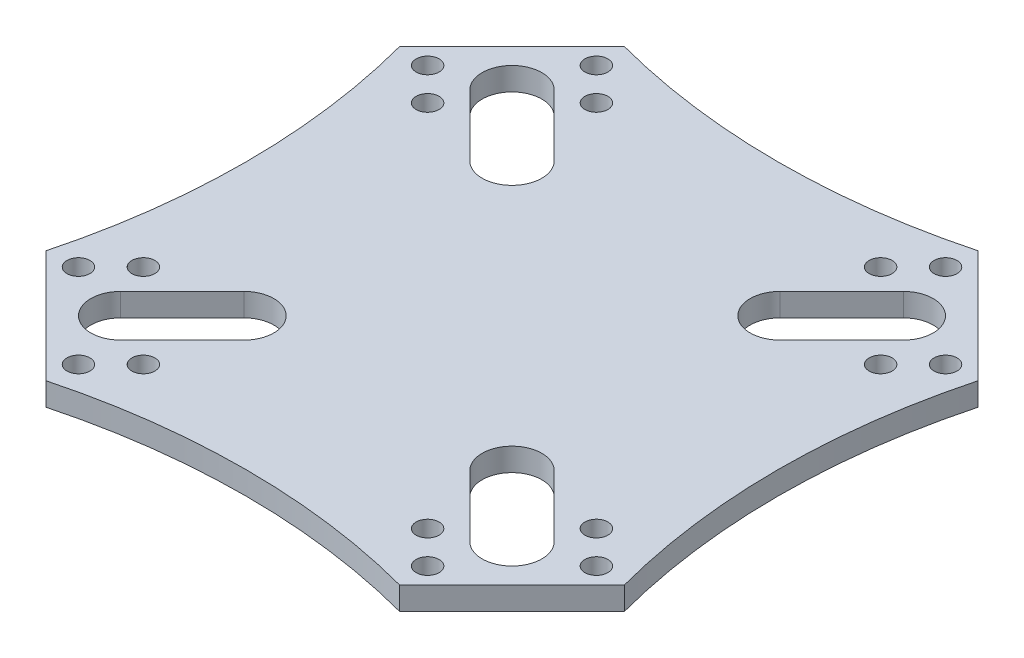
from build123d import *

# Parameters (mm, degrees)
EXTRUDE_2_DEPTH                    = 2.5
SKETCH_2_R                         = 2.5
CUT_EXTRUDE_1_DEPTH                = 90.270945965
PATTERN_LINEAR_1_COUNT             = 2
PATTERN_LINEAR_1_PITCH             = 10
PATTERN_CIRCULAR_1_COPY_1_SKETCH_R = 2.5
PATTERN_CIRCULAR_1_COPY_1_DEPTH    = 90.270945965
PATTERN_CIRCULAR_1_COPY_2_SKETCH_R = 2.5
PATTERN_CIRCULAR_1_COPY_2_DEPTH    = 90.270945965
PATTERN_CIRCULAR_1_COPY_3_SKETCH_R = 2.5
PATTERN_CIRCULAR_1_COPY_3_DEPTH    = 90.270945965
PATTERN_CIRCULAR_1_COPY_4_SKETCH_R = 2.5
PATTERN_CIRCULAR_1_COPY_4_DEPTH    = 90.270945965
PATTERN_CIRCULAR_1_COPY_5_SKETCH_R = 2.5
PATTERN_CIRCULAR_1_COPY_5_DEPTH    = 90.270945965
PATTERN_CIRCULAR_1_COPY_6_SKETCH_R = 2.5
PATTERN_CIRCULAR_1_COPY_6_DEPTH    = 90.270945965


with BuildPart() as part:
    # 草图1 → 凸台-拉伸2 (new, symmetric)
    with BuildSketch(Plane(origin=(0, 0, 0), x_dir=(1, 0, 0), z_dir=(0, 1, 0))):
        with BuildLine():
            Line((38.5, 63.025002156), (63.025002156, 38.5))
            ThreePointArc((63.025002156, 38.5), (58, 0), (63.025002156, -38.5))
            Line((63.025002156, -38.5), (38.5, -63.025002156))
            ThreePointArc((38.5, -63.025002156), (0, -58), (-38.5, -63.025002156))
            Line((-38.5, -63.025002156), (-63.025002156, -38.5))
            ThreePointArc((-63.025002156, -38.5), (-58, 0), (-63.025002156, 38.5))
            Line((-63.025002156, 38.5), (-38.5, 63.025002156))
            ThreePointArc((-38.5, 63.025002156), (0, 58), (38.5, 63.025002156))
        make_face()
        with BuildLine():
            Line((24.599550174, 33.791938329), (38.034579016, 47.226967172))
            ThreePointArc((38.034579016, 47.226967172), (47.226967172, 47.226967172), (47.226967172, 38.034579016))
            Line((47.226967172, 38.034579016), (33.791938329, 24.599550174))
            ThreePointArc((33.791938329, 24.599550174), (24.599550174, 24.599550174), (24.599550174, 33.791938329))
        make_face(mode=Mode.SUBTRACT)
        with BuildLine():
            Line((33.791938329, -24.599550174), (47.226967172, -38.034579016))
            ThreePointArc((47.226967172, -38.034579016), (47.226967172, -47.226967172), (38.034579016, -47.226967172))
            Line((38.034579016, -47.226967172), (24.599550174, -33.791938329))
            ThreePointArc((24.599550174, -33.791938329), (24.599550174, -24.599550174), (33.791938329, -24.599550174))
        make_face(mode=Mode.SUBTRACT)
        with BuildLine():
            Line((-24.599550174, -33.791938329), (-38.034579016, -47.226967172))
            ThreePointArc((-38.034579016, -47.226967172), (-47.226967172, -47.226967172), (-47.226967172, -38.034579016))
            Line((-47.226967172, -38.034579016), (-33.791938329, -24.599550174))
            ThreePointArc((-33.791938329, -24.599550174), (-24.599550174, -24.599550174), (-24.599550174, -33.791938329))
        make_face(mode=Mode.SUBTRACT)
        with BuildLine():
            Line((-33.791938329, 24.599550174), (-47.226967172, 38.034579016))
            ThreePointArc((-47.226967172, 38.034579016), (-47.226967172, 47.226967172), (-38.034579016, 47.226967172))
            Line((-38.034579016, 47.226967172), (-24.599550174, 33.791938329))
            ThreePointArc((-24.599550174, 33.791938329), (-24.599550174, 24.599550174), (-33.791938329, 24.599550174))
        make_face(mode=Mode.SUBTRACT)
    extrude(amount=EXTRUDE_2_DEPTH, both=True)

    # 草图2 → 切除-拉伸1 (cut, through all)
    with BuildSketch(Plane(origin=(0, 2.5, 0), x_dir=(1, 0, 0), z_dir=(0, 1, 0))):
        with Locations((38.034579016, 56.419355327)):
            Circle(SKETCH_2_R)
        with Locations((56.419355327, 38.034579016)):
            Circle(SKETCH_2_R)
    cut_extrude_1 = extrude(amount=-CUT_EXTRUDE_1_DEPTH, mode=Mode.SUBTRACT)

    # 阵列(线性)1: 切除-拉伸1 ×2
    with Locations(*[Vector(-0.7071067811865513, 0, 0.7071067811865438) * (i * PATTERN_LINEAR_1_PITCH) for i in range(1, PATTERN_LINEAR_1_COUNT)]):
        add(cut_extrude_1, mode=Mode.SUBTRACT)

    # 阵列(圆周)1 copy 1 sketch → 阵列(圆周)1 copy 1 (cut, through all)
    with BuildSketch(Plane(origin=(7.071067812, 2.5, 7.071067812), x_dir=(0, 0, -1), z_dir=(0, 1, 0))):
        with Locations((38.034579016, 56.419355327)):
            Circle(PATTERN_CIRCULAR_1_COPY_1_SKETCH_R)
        with Locations((56.419355327, 38.034579016)):
            Circle(PATTERN_CIRCULAR_1_COPY_1_SKETCH_R)
    extrude(amount=-PATTERN_CIRCULAR_1_COPY_1_DEPTH, mode=Mode.SUBTRACT)

    # 阵列(圆周)1 copy 2 sketch → 阵列(圆周)1 copy 2 (cut, through all)
    with BuildSketch(Plane(origin=(7.071067812, 2.5, -7.071067812), x_dir=(-1, 0, 0), z_dir=(0, 1, 0))):
        with Locations((38.034579016, 56.419355327)):
            Circle(PATTERN_CIRCULAR_1_COPY_2_SKETCH_R)
        with Locations((56.419355327, 38.034579016)):
            Circle(PATTERN_CIRCULAR_1_COPY_2_SKETCH_R)
    extrude(amount=-PATTERN_CIRCULAR_1_COPY_2_DEPTH, mode=Mode.SUBTRACT)

    # 阵列(圆周)1 copy 3 sketch → 阵列(圆周)1 copy 3 (cut, through all)
    with BuildSketch(Plane(origin=(-7.071067812, 2.5, -7.071067812), x_dir=(0, 0, 1), z_dir=(0, 1, 0))):
        with Locations((38.034579016, 56.419355327)):
            Circle(PATTERN_CIRCULAR_1_COPY_3_SKETCH_R)
        with Locations((56.419355327, 38.034579016)):
            Circle(PATTERN_CIRCULAR_1_COPY_3_SKETCH_R)
    extrude(amount=-PATTERN_CIRCULAR_1_COPY_3_DEPTH, mode=Mode.SUBTRACT)

    # 阵列(圆周)1 copy 4 sketch → 阵列(圆周)1 copy 4 (cut, through all)
    with BuildSketch(Plane(origin=(0, 2.5, 0), x_dir=(0, 0, -1), z_dir=(0, 1, 0))):
        with Locations((38.034579016, 56.419355327)):
            Circle(PATTERN_CIRCULAR_1_COPY_4_SKETCH_R)
        with Locations((56.419355327, 38.034579016)):
            Circle(PATTERN_CIRCULAR_1_COPY_4_SKETCH_R)
    extrude(amount=-PATTERN_CIRCULAR_1_COPY_4_DEPTH, mode=Mode.SUBTRACT)

    # 阵列(圆周)1 copy 5 sketch → 阵列(圆周)1 copy 5 (cut, through all)
    with BuildSketch(Plane(origin=(0, 2.5, 0), x_dir=(-1, 0, 0), z_dir=(0, 1, 0))):
        with Locations((38.034579016, 56.419355327)):
            Circle(PATTERN_CIRCULAR_1_COPY_5_SKETCH_R)
        with Locations((56.419355327, 38.034579016)):
            Circle(PATTERN_CIRCULAR_1_COPY_5_SKETCH_R)
    extrude(amount=-PATTERN_CIRCULAR_1_COPY_5_DEPTH, mode=Mode.SUBTRACT)

    # 阵列(圆周)1 copy 6 sketch → 阵列(圆周)1 copy 6 (cut, through all)
    with BuildSketch(Plane.ZX.offset(2.5)):
        with Locations((38.034579016, 56.419355327)):
            Circle(PATTERN_CIRCULAR_1_COPY_6_SKETCH_R)
        with Locations((56.419355327, 38.034579016)):
            Circle(PATTERN_CIRCULAR_1_COPY_6_SKETCH_R)
    extrude(amount=-PATTERN_CIRCULAR_1_COPY_6_DEPTH, mode=Mode.SUBTRACT)


solid = part.part
